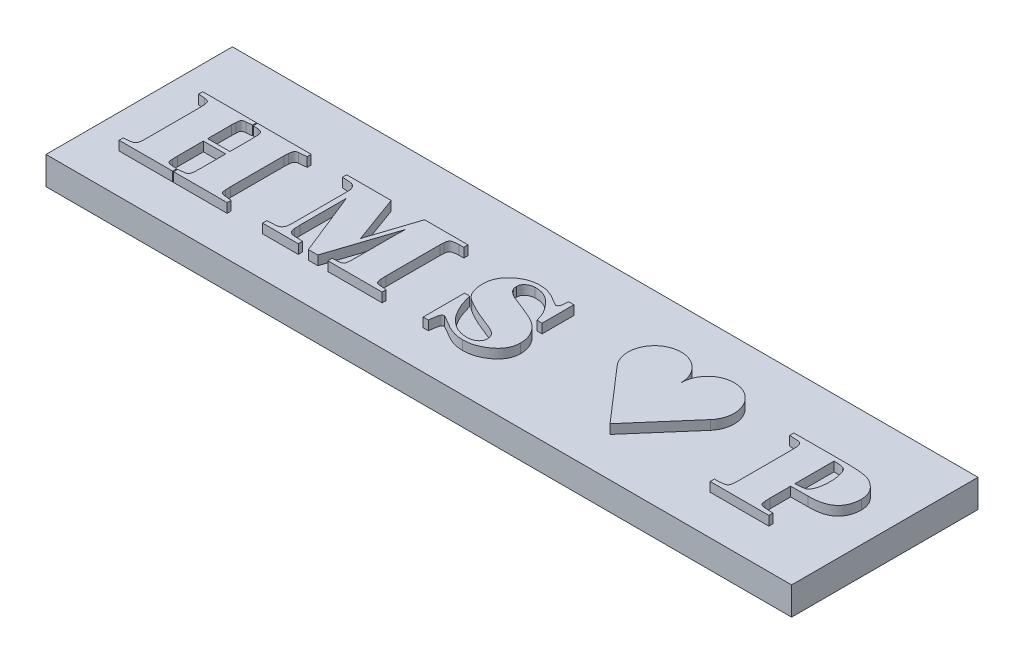
from build123d import *

# Parameters (mm, degrees)
SKETCH1_W           = 40
SKETCH1_H           = 10
BOSS_EXTRUDE1_DEPTH = 1.5
BOSS_EXTRUDE5_DEPTH = 0.5


# Read off the part's stored shape, not the designer's step: Boss-Extrude5
with BuildPart() as part:
    # Sketch1 → Boss-Extrude1 (new body)
    with BuildSketch(Plane(origin=(0, 0, 0), x_dir=(1, 0, 0), z_dir=(0, 1, 0))):
        Rectangle(SKETCH1_W, SKETCH1_H)
    extrude(amount=BOSS_EXTRUDE1_DEPTH)

    # Boss-Extrude5 outline → Boss-Extrude5 (add)
    # profile 1 of 5: a face of its own
    with BuildSketch(Plane(origin=(0, 1.5, 0), x_dir=(1, 0, 0), z_dir=(0, 1, 0))):
        with BuildLine():
            add(Edge.make_bspline(
                [(-15.001582278, -2.634119404), (-14.975088094, -2.630512991), (-14.926695955, -2.623925807), (-14.862529547, -2.607628229), (-14.81380472, -2.587634235), (-14.776593293, -2.562021346), (-14.753440151, -2.522255718), (-14.736625188, -2.470161899), (-14.722599912, -2.402068732), (-14.717697467, -2.35086483), (-14.714992089, -2.322608328)],
                knots=[0, 0, 0, 0, 0.164595913, 0.300637613, 0.40618912, 0.488400851, 0.573033149, 0.683392263, 0.825282312, 1, 1, 1, 1], degree=3))
            Line((-15.001582278, -2.634119404), (-15.27304193, -2.657260227))
            Line((-15.27304193, -2.657260227), (-15.27304193, -2.879768138))
            Line((-15.27304193, -2.879768138), (-12.404469937, -2.879768138))
            Line((-12.404469937, -2.879768138), (-12.404469937, -2.660820353))
            Line((-12.404469937, -2.660820353), (-12.793413766, -2.630559277))
            add(Edge.make_bspline(
                [(-13.039952532, -2.31815817), (-13.036946427, -2.347023814), (-13.031521498, -2.399115823), (-13.016875148, -2.468352375), (-13.0019458, -2.521788281), (-12.979348753, -2.560931128), (-12.947054318, -2.587111254), (-12.905632408, -2.605948226), (-12.853686546, -2.622225913), (-12.81461138, -2.627628478), (-12.793413766, -2.630559277)],
                knots=[0, 0, 0, 0, 0.192076942, 0.346629144, 0.468439447, 0.558431583, 0.640711966, 0.739148355, 0.858492413, 1, 1, 1, 1], degree=3))
            Line((-13.039952532, -2.31815817), (-13.051522943, -2.045808486))
            Line((-13.051522943, -2.045808486), (-13.050632911, 0.826323634))
            Line((-13.050632911, 0.826323634), (-13.039952532, 1.05684183))
            add(Edge.make_bspline(
                [(-12.809434335, 1.368352906), (-12.82678105, 1.365681812), (-12.859742987, 1.360606243), (-12.904375329, 1.344298132), (-12.942031964, 1.323772882), (-12.973774882, 1.296815524), (-12.998230381, 1.257291005), (-13.01654358, 1.204198856), (-13.031443835, 1.135765535), (-13.036937211, 1.084810899), (-13.039952532, 1.05684183)],
                knots=[0, 0, 0, 0, 0.121360463, 0.230607127, 0.327250476, 0.417564353, 0.515640177, 0.645088798, 0.805188763, 1, 1, 1, 1], degree=3))
            Line((-12.809434335, 1.368352906), (-12.392009494, 1.400394046))
            Line((-12.392009494, 1.400394046), (-12.392009494, 1.620231862))
            Line((-12.392009494, 1.620231862), (-15.27304193, 1.620231862))
            Line((-15.27304193, 1.620231862), (-15.27304193, 1.396833919))
            Line((-15.27304193, 1.396833919), (-15.001582278, 1.374583128))
            add(Edge.make_bspline(
                [(-14.714992089, 1.073752432), (-14.717781075, 1.100211011), (-14.722863904, 1.148430847), (-14.736230167, 1.213390793), (-14.755386274, 1.263086825), (-14.779833083, 1.301777767), (-14.817267052, 1.328100202), (-14.8659204, 1.34892689), (-14.929216973, 1.364002081), (-14.976007103, 1.370843599), (-15.001582278, 1.374583128)],
                knots=[0, 0, 0, 0, 0.168055448, 0.306275169, 0.417285206, 0.50357084, 0.590525443, 0.701266249, 0.836714108, 1, 1, 1, 1], degree=3))
            Line((-14.714992089, 1.073752432), (-14.702531646, 0.805852906))
            Line((-14.702531646, 0.805852906), (-14.702531646, -0.430401049))
            Line((-14.702531646, -0.430401049), (-15.898734177, -0.430401049))
            Line((-15.898734177, -0.430401049), (-15.898734177, 0.84590433))
            Line((-15.898734177, 0.84590433), (-15.887163766, 1.076422527))
            add(Edge.make_bspline(
                [(-15.653975475, 1.374583128), (-15.674811462, 1.37207573), (-15.713300338, 1.367443988), (-15.765333061, 1.354590643), (-15.806895732, 1.336816984), (-15.840689669, 1.312828954), (-15.863117639, 1.274512815), (-15.877240936, 1.222713231), (-15.885119672, 1.154975869), (-15.886437556, 1.104330355), (-15.887163766, 1.076422527)],
                knots=[0, 0, 0, 0, 0.142311329, 0.262881868, 0.36199024, 0.448132688, 0.538587183, 0.656370766, 0.810645699, 1, 1, 1, 1], degree=3))
            Line((-15.653975475, 1.374583128), (-15.328223892, 1.401284077))
            Line((-15.328223892, 1.401284077), (-15.328223892, 1.620231862))
            Line((-15.328223892, 1.620231862), (-18.209256329, 1.620231862))
            Line((-18.209256329, 1.620231862), (-18.209256329, 1.396833919))
            Line((-18.209256329, 1.396833919), (-17.860363924, 1.37013297))
            add(Edge.make_bspline(
                [(-17.563093354, 1.05684183), (-17.566278463, 1.083288241), (-17.572114107, 1.131742427), (-17.585295702, 1.197607264), (-17.604685902, 1.248916399), (-17.628664957, 1.289847186), (-17.665641583, 1.319818643), (-17.716922683, 1.3408045), (-17.782847658, 1.35953039), (-17.832926603, 1.366380127), (-17.860363924, 1.37013297)],
                knots=[0, 0, 0, 0, 0.162394421, 0.297533361, 0.408016985, 0.495807726, 0.583094185, 0.692342652, 0.831440274, 1, 1, 1, 1], degree=3))
            Line((-17.563093354, 1.05684183), (-17.550632911, 0.785382178))
            Line((-17.550632911, 0.785382178), (-17.550632911, -2.046698518))
            Line((-17.550632911, -2.046698518), (-17.563093354, -2.317268138))
            add(Edge.make_bspline(
                [(-17.845233386, -2.628779214), (-17.821357263, -2.624958533), (-17.777164319, -2.617886736), (-17.71793914, -2.599119644), (-17.67008328, -2.576704803), (-17.633282481, -2.546275368), (-17.606223354, -2.505812097), (-17.586585747, -2.454093223), (-17.571798582, -2.389971126), (-17.566157743, -2.34286083), (-17.563093354, -2.317268138)],
                knots=[0, 0, 0, 0, 0.153337732, 0.283816832, 0.393342131, 0.486931964, 0.583084326, 0.698878596, 0.836415644, 1, 1, 1, 1], degree=3))
            Line((-17.845233386, -2.628779214), (-18.196795886, -2.657260227))
            Line((-18.196795886, -2.657260227), (-18.196795886, -2.879768138))
            Line((-18.196795886, -2.879768138), (-15.328223892, -2.879768138))
            Line((-15.328223892, -2.879768138), (-15.328223892, -2.661710385))
            Line((-15.328223892, -2.661710385), (-15.652195411, -2.634119404))
            add(Edge.make_bspline(
                [(-15.887163766, -2.324388391), (-15.88661012, -2.354096533), (-15.885615228, -2.407481592), (-15.876092147, -2.478284757), (-15.862580703, -2.531722201), (-15.840028759, -2.570620277), (-15.805496256, -2.593800561), (-15.763680793, -2.611172241), (-15.711541902, -2.625193829), (-15.673039494, -2.630984502), (-15.652195411, -2.634119404)],
                knots=[0, 0, 0, 0, 0.196707415, 0.353480103, 0.472275171, 0.560613516, 0.643561442, 0.74215054, 0.860407813, 1, 1, 1, 1], degree=3))
            Line((-15.887163766, -2.324388391), (-15.899624209, -2.044028423))
            Line((-15.899624209, -2.044028423), (-15.898734177, -0.658249151))
            Line((-15.898734177, -0.658249151), (-14.702531646, -0.658249151))
            Line((-14.702531646, -0.658249151), (-14.702531646, -2.044918454))
            Line((-14.702531646, -2.044918454), (-14.714992089, -2.322608328))
        make_face()
    # profile 2 of 5: a face of its own
    with BuildSketch(Plane(origin=(0, 1.5, 0), x_dir=(1, 0, 0), z_dir=(0, 1, 0))):
        with BuildLine():
            add(Edge.make_bspline(
                [(-6.386075949, 0.185500849), (-6.385966673, 0.218732433), (-6.385739278, 0.287884175), (-6.381591194, 0.395572194), (-6.376669589, 0.511322839), (-6.370539677, 0.599623584), (-6.367089402, 0.649405018), (-6.366492452, 0.6579588)],
                knots=[0, 0, 0, 0, 0.114920202, 0.239137934, 0.372664128, 0.515581263, 0.545234724, 0.545234724, 0.545234724, 0.545234724], degree=3))
            Line((-6.386075949, 0.185500849), (-6.386075949, -2.052038708))
            Line((-6.386075949, -2.052038708), (-6.397646361, -2.326168454))
            add(Edge.make_bspline(
                [(-6.678006329, -2.635009435), (-6.652067274, -2.631506209), (-6.605061195, -2.625157754), (-6.543143429, -2.607893217), (-6.495291351, -2.589623243), (-6.459407089, -2.563762072), (-6.437095992, -2.524374301), (-6.418650145, -2.473172967), (-6.406907234, -2.404786245), (-6.400933303, -2.354072104), (-6.397646361, -2.326168454)],
                knots=[0, 0, 0, 0, 0.163707455, 0.296666386, 0.401561892, 0.483683985, 0.567181473, 0.680033902, 0.823950054, 1, 1, 1, 1], degree=3))
            Line((-6.678006329, -2.635009435), (-7.004647943, -2.656370195))
            Line((-7.004647943, -2.656370195), (-7.004647943, -2.879768138))
            Line((-7.004647943, -2.879768138), (-4.088014241, -2.879768138))
            Line((-4.088014241, -2.879768138), (-4.088014241, -2.660820353))
            Line((-4.088014241, -2.660820353), (-4.492088608, -2.628779214))
            add(Edge.make_bspline(
                [(-4.724386867, -2.31281798), (-4.721386393, -2.34167588), (-4.715905204, -2.394392737), (-4.700953802, -2.464419993), (-4.683987901, -2.518427886), (-4.662364295, -2.558618286), (-4.631337663, -2.58582061), (-4.592835692, -2.604816668), (-4.545742057, -2.620078222), (-4.51089426, -2.625729497), (-4.492088608, -2.628779214)],
                knots=[0, 0, 0, 0, 0.19690421, 0.359699451, 0.485203268, 0.580911852, 0.665067415, 0.760584985, 0.870799419, 1, 1, 1, 1], degree=3))
            Line((-4.724386867, -2.31281798), (-4.735067247, -2.037798201))
            Line((-4.735067247, -2.037798201), (-4.734177215, 0.8619249))
            Line((-4.734177215, 0.8619249), (-4.724386867, 1.077312558))
            add(Edge.make_bspline(
                [(-4.232199367, 1.392383761), (-4.242587625, 1.392184308), (-4.268153352, 1.391693451), (-4.313263674, 1.387697337), (-4.372504947, 1.380966417), (-4.441325305, 1.374466318), (-4.51065137, 1.363564741), (-4.571704893, 1.349942896), (-4.618850992, 1.329395722), (-4.656153669, 1.304248888), (-4.6815141, 1.266041589), (-4.70011188, 1.216171792), (-4.714890366, 1.151762824), (-4.721009359, 1.103791405), (-4.724386867, 1.077312558)],
                knots=[0, 0, 0, 0, 0.046034389, 0.113291624, 0.200550599, 0.310312985, 0.419467395, 0.511620618, 0.586375576, 0.646595457, 0.707882266, 0.785762784, 0.881747206, 1, 1, 1, 1], degree=3))
            Line((-4.232199367, 1.392383761), (-3.97943038, 1.392383761))
            Line((-3.97943038, 1.392383761), (-3.97943038, 1.620231862))
            Line((-3.97943038, 1.620231862), (-6.308643196, 1.620231862))
            Line((-6.308643196, 1.620231862), (-7.158623418, -0.967980163))
            Line((-7.158623418, -0.967980163), (-8.103837025, 1.620231862))
            Line((-8.103837025, 1.620231862), (-10.487341772, 1.620231862))
            Line((-10.487341772, 1.620231862), (-10.487341772, 1.397723951))
            add(Edge.make_bspline(
                [(-9.701443829, 1.047941514), (-9.708158775, 1.068262827), (-9.721371436, 1.108248055), (-9.74759381, 1.164254744), (-9.780680367, 1.21373942), (-9.816534533, 1.258364122), (-9.857882945, 1.296909669), (-9.905616879, 1.325969597), (-9.957967284, 1.348323708), (-10.035013064, 1.36289366), (-10.134005242, 1.373829734), (-10.253247261, 1.380874899), (-10.371162334, 1.387172193), (-10.448790387, 1.394222601), (-10.487341772, 1.397723951)],
                knots=[0, 0, 0, 0, 0.06814184, 0.134079279, 0.1961954, 0.257296956, 0.316158012, 0.375155444, 0.434469865, 0.496377191, 0.623900921, 0.751753331, 0.876716566, 1, 1, 1, 1], degree=3))
            Line((-9.701443829, 1.047941514), (-9.689873418, 0.785382178))
            Line((-9.689873418, 0.785382178), (-9.689873418, -1.980836176))
            Line((-9.689873418, -1.980836176), (-9.702333861, -2.265646303))
            add(Edge.make_bspline(
                [(-10.499802215, -2.656370195), (-10.455020611, -2.653374172), (-10.372612604, -2.647860831), (-10.25228625, -2.644651974), (-10.133232416, -2.636761794), (-10.029416923, -2.627634191), (-9.943697327, -2.610332429), (-9.884600016, -2.588654419), (-9.833866076, -2.557361702), (-9.791231816, -2.517621995), (-9.756620013, -2.467841933), (-9.730518042, -2.408868795), (-9.711503574, -2.34047336), (-9.705511836, -2.291579344), (-9.702333861, -2.265646303)],
                knots=[0, 0, 0, 0, 0.13348818, 0.245647628, 0.357942385, 0.488430381, 0.555241526, 0.617522313, 0.674582857, 0.731397213, 0.789666415, 0.85364336, 0.922373468, 1, 1, 1, 1], degree=3))
            Line((-10.499802215, -2.656370195), (-10.499802215, -2.879768138))
            Line((-10.499802215, -2.879768138), (-8.586234177, -2.879768138))
            Line((-8.586234177, -2.879768138), (-8.586234177, -2.659930322))
            Line((-8.586234177, -2.659930322), (-9.107792722, -2.623439024))
            add(Edge.make_bspline(
                [(-9.394382911, -2.261196144), (-9.390783184, -2.290650787), (-9.384109705, -2.345256293), (-9.366900942, -2.419943902), (-9.343187202, -2.48093864), (-9.312602866, -2.529553931), (-9.272719052, -2.565850424), (-9.22577697, -2.5935624), (-9.169843227, -2.613431253), (-9.129307552, -2.61996902), (-9.107792722, -2.623439024)],
                knots=[0, 0, 0, 0, 0.173653238, 0.321933046, 0.447391543, 0.555296573, 0.65484072, 0.759984849, 0.872608873, 1, 1, 1, 1], degree=3))
            Line((-9.394382911, -2.261196144), (-9.405953323, -1.976386018))
            Line((-9.405953323, -1.976386018), (-9.405141196, 0.525775601))
            Line((-9.405141196, 0.525775601), (-8.042424842, -2.879768138))
            Line((-8.042424842, -2.879768138), (-7.537776899, -2.879768138))
            Line((-7.537776899, -2.879768138), (-6.459948576, 0.383087875))
            Line((-6.459948576, 0.383087875), (-6.366492452, 0.6579588))
        make_face()
    # profile 3 of 5: a face of its own
    with BuildSketch(Plane(origin=(0, 1.5, 0), x_dir=(1, 0, 0), z_dir=(0, 1, 0))):
        with BuildLine():
            add(Edge.make_bspline(
                [(-0.746835443, 0.993649584), (-0.74536001, 0.95842561), (-0.74249664, 0.890066537), (-0.71357404, 0.793357329), (-0.668669437, 0.705995609), (-0.603755642, 0.631635803), (-0.527420634, 0.567156181), (-0.445570191, 0.506667308), (-0.356004261, 0.454420477), (-0.25734597, 0.407073125), (-0.144667653, 0.360479114), (-0.013883882, 0.308281701), (0.137444834, 0.248222158), (0.308051562, 0.183948023), (0.491479239, 0.113524641), (0.6810593, 0.035060839), (0.873906708, -0.049940556), (1.036966169, -0.123406026), (1.166770258, -0.18671078), (1.260009579, -0.241691302), (1.34885612, -0.302101642), (1.433592047, -0.368097492), (1.513873299, -0.439441978), (1.589901358, -0.516508727), (1.661850119, -0.598899601), (1.728524322, -0.686893583), (1.788876412, -0.779372907), (1.843064278, -0.875473692), (1.886977569, -0.976281789), (1.924099957, -1.080248302), (1.952159892, -1.187816566), (1.97315274, -1.29897335), (1.984349061, -1.413952778), (1.986335531, -1.491890867), (1.987341772, -1.531370195)],
                knots=[0, 0, 0, 0, 0.026271138, 0.050984329, 0.074800032, 0.099199579, 0.124200839, 0.149448905, 0.175206422, 0.201598111, 0.231222891, 0.266362204, 0.306898554, 0.352960473, 0.402685656, 0.453811837, 0.506362542, 0.560266849, 0.587549755, 0.614297078, 0.64112432, 0.667838504, 0.694551766, 0.721376256, 0.748735718, 0.776288763, 0.803854307, 0.831262293, 0.858674767, 0.885968494, 0.913734162, 0.941711718, 0.970474228, 1, 1, 1, 1], degree=3))
            add(Edge.make_bspline(
                [(-0.202136076, 1.449345786), (-0.234013839, 1.447723663), (-0.298004884, 1.444467432), (-0.39279841, 1.420267455), (-0.484917774, 1.380392708), (-0.572263029, 1.327489082), (-0.649550989, 1.262385069), (-0.706636807, 1.18288901), (-0.741484666, 1.091590917), (-0.745019546, 1.026888002), (-0.746835443, 0.993649584)],
                knots=[0, 0, 0, 0, 0.121610338, 0.244119151, 0.370969357, 0.503632024, 0.632866389, 0.753858137, 0.873554906, 1, 1, 1, 1], degree=3))
            add(Edge.make_bspline(
                [(1.374109968, -0.031666872), (1.366252482, -0.00491851), (1.349324649, 0.052707016), (1.318896671, 0.143670451), (1.282854018, 0.245684404), (1.242135678, 0.359117718), (1.187943269, 0.483058575), (1.111420705, 0.613435213), (1.012804652, 0.750848998), (0.897967234, 0.891908944), (0.774700527, 1.027880985), (0.647559053, 1.146348937), (0.522471806, 1.244702954), (0.394835115, 1.321584863), (0.261617118, 1.380230712), (0.117943026, 1.420972334), (-0.038145377, 1.44510274), (-0.146272122, 1.447900379), (-0.202136076, 1.449345786)],
                knots=[0, 0, 0, 0, 0.035906866, 0.077356214, 0.123523959, 0.175272454, 0.232580615, 0.297470079, 0.369568945, 0.450258278, 0.531668307, 0.605756047, 0.673860524, 0.736251134, 0.797168506, 0.860787532, 0.92807553, 1, 1, 1, 1], degree=3))
            Line((1.374109968, -0.031666872), (1.64556962, -0.031666872))
            Line((1.64556962, -0.031666872), (1.64556962, 1.677193887))
            Line((1.64556962, 1.677193887), (1.360759494, 1.677193887))
            add(Edge.make_bspline(
                [(1.178303006, 1.164535659), (1.192872855, 1.16611171), (1.222179591, 1.169281879), (1.261974291, 1.195146357), (1.293186389, 1.236979688), (1.318646727, 1.293485071), (1.337323053, 1.366025505), (1.351001358, 1.454845522), (1.35973843, 1.56042975), (1.360403904, 1.636530286), (1.360759494, 1.677193887)],
                knots=[0, 0, 0, 0, 0.073703244, 0.148251473, 0.233102023, 0.336401283, 0.461618154, 0.612966137, 0.793192121, 1, 1, 1, 1], degree=3))
            Line((1.178303006, 1.164535659), (0.583761867, 1.497407495))
            add(Edge.make_bspline(
                [(-0.151404272, 1.677193887), (-0.088669325, 1.674811072), (0.036760548, 1.670046961), (0.223461219, 1.636204065), (0.407108198, 1.579076769), (0.524376168, 1.524862271), (0.583761867, 1.497407495)],
                knots=[0, 0, 0, 0, 0.246456156, 0.49275509, 0.74312599, 1, 1, 1, 1], degree=3))
            add(Edge.make_bspline(
                [(-1.772151899, 0.21309183), (-1.770584598, 0.263318996), (-1.767488695, 0.362533112), (-1.743736956, 0.508230636), (-1.705228705, 0.648151664), (-1.65210364, 0.782405892), (-1.581383277, 0.909612003), (-1.496616821, 1.031214238), (-1.395830924, 1.146385972), (-1.282070313, 1.254886716), (-1.157864776, 1.35293449), (-1.028274161, 1.440388709), (-0.893451668, 1.513453288), (-0.754060649, 1.57338875), (-0.609880315, 1.620170959), (-0.46104509, 1.652343669), (-0.307809254, 1.674269383), (-0.203994346, 1.676210543), (-0.151404272, 1.677193887)],
                knots=[0, 0, 0, 0, 0.062204273, 0.122872591, 0.182349013, 0.241728823, 0.301276751, 0.362251589, 0.425042733, 0.490555683, 0.556740526, 0.620861198, 0.684017035, 0.74641971, 0.80860552, 0.871475145, 0.934892476, 1, 1, 1, 1], degree=3))
            add(Edge.make_bspline(
                [(-1.299545095, -0.858506271), (-1.337294966, -0.833309104), (-1.412645338, -0.783014473), (-1.50885915, -0.685490655), (-1.592233855, -0.574408744), (-1.657649818, -0.445982441), (-1.709456485, -0.303075208), (-1.746267496, -0.144762208), (-1.768712504, 0.029100011), (-1.770974832, 0.150124171), (-1.772151899, 0.21309183)],
                knots=[0, 0, 0, 0, 0.110755835, 0.221073428, 0.333112562, 0.449304402, 0.572116466, 0.704119735, 0.846056458, 1, 1, 1, 1], degree=3))
            add(Edge.make_bspline(
                [(0.905063291, -2.25318586), (0.903638351, -2.215668361), (0.900927406, -2.144291419), (0.87744058, -2.04314882), (0.838314346, -1.954006155), (0.779669218, -1.875399333), (0.699005258, -1.803819236), (0.591835205, -1.736708201), (0.458422197, -1.666880931), (0.29850886, -1.600971646), (0.122358616, -1.531570348), (-0.062505211, -1.457751458), (-0.25350044, -1.380752915), (-0.451637308, -1.301633817), (-0.656204154, -1.21307565), (-0.86491792, -1.107577365), (-1.081888599, -0.990930949), (-1.225767948, -0.903393123), (-1.299545095, -0.858506271)],
                knots=[0, 0, 0, 0, 0.041215804, 0.078412958, 0.113463202, 0.147527654, 0.185409671, 0.231382499, 0.286256452, 0.350862845, 0.421448381, 0.494517961, 0.569768794, 0.647928615, 0.729160766, 0.814813628, 0.905041812, 1, 1, 1, 1], degree=3))
            add(Edge.make_bspline(
                [(0.299841772, -2.708882062), (0.342972755, -2.707136062), (0.425856079, -2.703780833), (0.543912079, -2.679370402), (0.648605233, -2.635925879), (0.738241526, -2.576467933), (0.811054726, -2.505819446), (0.865750025, -2.428129845), (0.898890077, -2.342617796), (0.902996322, -2.283130238), (0.905063291, -2.25318586)],
                knots=[0, 0, 0, 0, 0.153956857, 0.295853595, 0.427853137, 0.556237336, 0.677585662, 0.788058432, 0.893314524, 1, 1, 1, 1], degree=3))
            add(Edge.make_bspline(
                [(-1.56210443, -0.715211176), (-1.553270159, -0.745491974), (-1.534105484, -0.811181788), (-1.501464417, -0.917420743), (-1.465370947, -1.039860605), (-1.42450843, -1.178196528), (-1.37192461, -1.330019444), (-1.299271269, -1.491990632), (-1.210706271, -1.665713384), (-1.107591439, -1.847655387), (-0.987903058, -2.027571665), (-0.847811739, -2.19235002), (-0.69200729, -2.339964983), (-0.549798186, -2.448814862), (-0.428537427, -2.524803854), (-0.333637698, -2.573597317), (-0.236172142, -2.616333518), (-0.134868267, -2.649265996), (-0.030741784, -2.67691872), (0.07685647, -2.694798257), (0.187409631, -2.707156805), (0.26212859, -2.708303358), (0.299841772, -2.708882062)],
                knots=[0, 0, 0, 0, 0.032058659, 0.069546626, 0.112955303, 0.161793716, 0.216152654, 0.276098588, 0.342040466, 0.414297442, 0.48856181, 0.561299738, 0.633604513, 0.706334941, 0.742899623, 0.77890806, 0.814699962, 0.850933678, 0.887061852, 0.924092282, 0.96168681, 1, 1, 1, 1], degree=3))
            Line((-1.56210443, -0.715211176), (-1.829113924, -0.715211176))
            Line((-1.829113924, -0.715211176), (-1.829113924, -2.936730163))
            Line((-1.829113924, -2.936730163), (-1.552314082, -2.936730163))
            add(Edge.make_bspline(
                [(-1.321795886, -2.310147885), (-1.338073421, -2.311374451), (-1.369558207, -2.313746935), (-1.412760509, -2.336774587), (-1.444107136, -2.376220962), (-1.463878713, -2.417990381), (-1.475933731, -2.460596388), (-1.485384881, -2.502597884), (-1.496249944, -2.553247493), (-1.506778845, -2.612934215), (-1.517041751, -2.681285437), (-1.529114278, -2.758308481), (-1.540198542, -2.844458415), (-1.548146251, -2.904988032), (-1.552314082, -2.936730163)],
                knots=[0, 0, 0, 0, 0.06776762, 0.131079364, 0.198000285, 0.275177456, 0.323096399, 0.383019194, 0.455330472, 0.539828243, 0.636570394, 0.74454424, 0.866037313, 1, 1, 1, 1], degree=3))
            add(Edge.make_bspline(
                [(0.282041139, -2.936730163), (0.237508146, -2.935551227), (0.148815224, -2.933203232), (0.016001476, -2.918915356), (-0.115270458, -2.893514907), (-0.246390826, -2.859933425), (-0.375731015, -2.814942338), (-0.504849579, -2.76169424), (-0.631898955, -2.697034862), (-0.755523834, -2.625245695), (-0.870499752, -2.552069173), (-0.976400028, -2.489246695), (-1.067169195, -2.434455229), (-1.14524722, -2.391457136), (-1.20783822, -2.355408793), (-1.258281757, -2.332272507), (-1.293755696, -2.314709063), (-1.314300334, -2.311367154), (-1.321795886, -2.310147885)],
                knots=[0, 0, 0, 0, 0.076481606, 0.152322503, 0.229061601, 0.305922368, 0.38454598, 0.464023294, 0.54559101, 0.629131657, 0.709435825, 0.779596701, 0.84058432, 0.891454838, 0.93272505, 0.964398351, 0.987011014, 1, 1, 1, 1], degree=3))
            add(Edge.make_bspline(
                [(1.987341772, -1.531370195), (1.985889377, -1.580423199), (1.983017973, -1.677401568), (1.957566251, -1.819563196), (1.914950031, -1.955226142), (1.857569739, -2.085513714), (1.780003914, -2.20752681), (1.689466899, -2.325591288), (1.579158782, -2.434722839), (1.455991692, -2.537447141), (1.322976705, -2.631107563), (1.183562844, -2.711618471), (1.042231431, -2.781940443), (0.896631239, -2.837973497), (0.748075375, -2.88311554), (0.595436233, -2.913710723), (0.439789758, -2.933256171), (0.334908417, -2.935565903), (0.282041139, -2.936730163)],
                knots=[0, 0, 0, 0, 0.060199253, 0.119014636, 0.176627426, 0.234515987, 0.29325121, 0.353735287, 0.416847988, 0.483315961, 0.55052655, 0.616320213, 0.68083878, 0.744161416, 0.807668221, 0.871255433, 0.935104045, 1, 1, 1, 1], degree=3))
        make_face()
    # profile 4 of 5: a face of its own
    with BuildSketch(Plane(origin=(0, 1.5, 0), x_dir=(1, 0, 0), z_dir=(0, 1, 0))):
        with BuildLine():
            add(Edge.make_bspline(
                [(15.896756329, -2.314598043), (15.900029258, -2.343182675), (15.906006646, -2.395387134), (15.922033115, -2.464765372), (15.939872112, -2.519211585), (15.96640644, -2.557948301), (15.999399172, -2.584460119), (16.038113328, -2.603640436), (16.083803584, -2.617942568), (16.155030415, -2.63008692), (16.252584508, -2.638699696), (16.377635211, -2.644398726), (16.514189019, -2.648443099), (16.608837664, -2.659470194), (16.658623418, -2.665270511)],
                knots=[0, 0, 0, 0, 0.089334166, 0.163152069, 0.221218087, 0.266243072, 0.306859461, 0.351400241, 0.399810796, 0.45515502, 0.575632115, 0.703973068, 0.844288063, 1, 1, 1, 1], degree=3))
            Line((15.896756329, -2.314598043), (15.885185918, -2.040468296))
            Line((15.885185918, -2.040468296), (15.886075949, -0.938609119))
            add(Edge.make_bspline(
                [(16.818829114, -0.931488866), (16.755933284, -0.93139613), (16.636667769, -0.931220281), (16.467563374, -0.932389361), (16.317740054, -0.933146761), (16.187798693, -0.93424693), (16.079200037, -0.934488299), (15.99377694, -0.936941916), (15.932055636, -0.937436976), (15.898832543, -0.93828392), (15.886075949, -0.938609119)],
                knots=[0, 0, 0, 0, 0.202279889, 0.383570981, 0.543871091, 0.684134449, 0.801498829, 0.893117146, 0.958960439, 1, 1, 1, 1], degree=3))
            add(Edge.make_bspline(
                [(18.392405063, 0.356386925), (18.391359033, 0.312138933), (18.389274149, 0.223946444), (18.373072447, 0.092814518), (18.344889972, -0.03622911), (18.307278625, -0.162464363), (18.258855092, -0.284066869), (18.192943887, -0.395101823), (18.116994611, -0.498734998), (18.025135353, -0.590083403), (17.922068452, -0.672028245), (17.806563482, -0.741921834), (17.680333857, -0.802133314), (17.5411882, -0.85024928), (17.386961757, -0.888123144), (17.214338527, -0.912476644), (17.022963582, -0.928887903), (16.888884315, -0.930596263), (16.818829114, -0.931488866)],
                knots=[0, 0, 0, 0, 0.057065209, 0.11373901, 0.17010708, 0.227250505, 0.283534078, 0.33840533, 0.393357922, 0.448830372, 0.504949787, 0.562836689, 0.62257612, 0.685026518, 0.752409338, 0.82709527, 0.909658846, 1, 1, 1, 1], degree=3))
            add(Edge.make_bspline(
                [(16.387163766, 1.625572052), (16.469945608, 1.624913788), (16.628464222, 1.623653282), (16.855657809, 1.613508842), (17.061355359, 1.594568677), (17.246101271, 1.570809093), (17.40911294, 1.538194509), (17.551189501, 1.498783864), (17.671978275, 1.451387525), (17.773139289, 1.395918911), (17.858199713, 1.335092928), (17.936129403, 1.275570618), (18.007028534, 1.215165002), (18.071983609, 1.154704685), (18.128557351, 1.092349215), (18.17918369, 1.0296029), (18.222653761, 0.965901907), (18.27101742, 0.880326964), (18.320012523, 0.771184349), (18.362070748, 0.635853255), (18.388006391, 0.497118847), (18.390936527, 0.40337153), (18.392405063, 0.356386925)],
                knots=[0, 0, 0, 0, 0.092479581, 0.177088773, 0.253965738, 0.323197368, 0.385077075, 0.439526139, 0.487716456, 0.529694894, 0.56803394, 0.604428348, 0.639227337, 0.672051015, 0.703486614, 0.733197595, 0.762062811, 0.789523871, 0.84293001, 0.895344802, 0.947548545, 1, 1, 1, 1], degree=3))
            Line((16.387163766, 1.625572052), (13.503461234, 1.620231862))
            Line((13.503461234, 1.620231862), (13.503461234, 1.395943887))
            add(Edge.make_bspline(
                [(14.221716772, 1.05150164), (14.218601565, 1.077662245), (14.212891484, 1.125613844), (14.198741768, 1.191427423), (14.176618553, 1.243448498), (14.14926121, 1.284474566), (14.113825655, 1.314112309), (14.072279487, 1.337527043), (14.022355586, 1.354069807), (13.947816379, 1.368062576), (13.854077188, 1.377926046), (13.742338101, 1.38398867), (13.62649742, 1.387438762), (13.546464322, 1.392971212), (13.503461234, 1.395943887)],
                knots=[0, 0, 0, 0, 0.086557298, 0.158656916, 0.220210345, 0.271308782, 0.318983879, 0.370480407, 0.427190938, 0.490838204, 0.619343219, 0.736492367, 0.858413057, 1, 1, 1, 1], degree=3))
            Line((14.221716772, 1.05150164), (14.234177215, 0.779151957))
            Line((14.234177215, 0.779151957), (14.234177215, -2.046698518))
            Line((14.234177215, -2.046698518), (14.221716772, -2.31815817))
            add(Edge.make_bspline(
                [(13.751780063, -2.651920037), (13.791225125, -2.646392107), (13.868290536, -2.635591968), (13.963177903, -2.624961797), (14.034165584, -2.614072675), (14.079340021, -2.59712884), (14.118712332, -2.57724694), (14.151816613, -2.549010475), (14.178865726, -2.510175688), (14.198441761, -2.457969123), (14.212947371, -2.392618841), (14.218633224, -2.344340467), (14.221716772, -2.31815817)],
                knots=[0, 0, 0, 0, 0.17998444, 0.351642879, 0.432127665, 0.503392336, 0.568787835, 0.630606754, 0.697953168, 0.780380817, 0.880896263, 1, 1, 1, 1], degree=3))
            Line((13.751780063, -2.651920037), (13.509691456, -2.651920037))
            Line((13.509691456, -2.651920037), (13.509691456, -2.879768138))
            Line((13.509691456, -2.879768138), (16.658623418, -2.879768138))
            Line((16.658623418, -2.879768138), (16.658623418, -2.665270511))
        make_face()
        with BuildLine():
            add(Edge.make_bspline(
                [(15.886075949, -0.715211176), (15.889919625, -0.714242435), (15.902735991, -0.711012261), (15.930021835, -0.709767113), (15.972052886, -0.706535221), (16.028269116, -0.704893573), (16.096480571, -0.699009607), (16.174988646, -0.691657574), (16.262027697, -0.67797164), (16.34011759, -0.667229382), (16.404213234, -0.65079373), (16.450672732, -0.630113232), (16.493104572, -0.6000436), (16.531117921, -0.561219349), (16.566346402, -0.514872784), (16.598348392, -0.460660381), (16.62543019, -0.397514752), (16.659148084, -0.302057525), (16.691437673, -0.170923464), (16.719714365, -0.003417998), (16.738152488, 0.175598833), (16.73970666, 0.29908154), (16.740506329, 0.362617147)],
                knots=[0, 0, 0, 0, 0.007235509, 0.024126103, 0.049667218, 0.084414085, 0.126840348, 0.17481383, 0.228501197, 0.287880137, 0.318797379, 0.349138474, 0.380283191, 0.413262574, 0.448081315, 0.486494571, 0.528013384, 0.573468444, 0.67146271, 0.774351508, 0.883896991, 1, 1, 1, 1], degree=3))
            Line((15.886075949, -0.715211176), (15.886075949, 1.392383761))
            add(Edge.make_bspline(
                [(16.740506329, 0.362617147), (16.73954769, 0.41665525), (16.737641431, 0.52411026), (16.720267257, 0.683599813), (16.691541946, 0.839952686), (16.659331847, 0.966407822), (16.629160988, 1.062645605), (16.602478831, 1.126131948), (16.574079163, 1.182597764), (16.542260027, 1.230244174), (16.508287391, 1.27090348), (16.470284743, 1.30168124), (16.430966476, 1.327467248), (16.344805585, 1.354362562), (16.213531576, 1.378895478), (16.070165314, 1.388449725), (15.969450131, 1.39059354), (15.91929289, 1.391090136), (15.894382169, 1.392060277), (15.886075949, 1.392383761)],
                knots=[0, 0, 0, 0, 0.101326501, 0.201488203, 0.300479219, 0.399268288, 0.446075168, 0.489477233, 0.52830041, 0.564413111, 0.5967631, 0.627184468, 0.655909756, 0.684244353, 0.795444025, 0.905934202, 0.953244414, 0.984409838, 1, 1, 1, 1], degree=3))
        make_face(mode=Mode.SUBTRACT)
    # profile 5 of 5: a face of its own
    with BuildSketch(Plane(origin=(0, 1.5, 0), x_dir=(1, 0, 0), z_dir=(0, 1, 0))):
        with BuildLine():
            Line((5.63996494, 0.000231862), (8.13996494, -2.879768138))
            Line((8.13996494, -2.879768138), (10.63996494, 0.000231862))
            ThreePointArc((10.63996494, 0.000231862), (10.062683148, 2.268280718), (8.13996494, 0.933943964))
            ThreePointArc((8.13996494, 0.933943964), (6.217246732, 2.268280718), (5.63996494, 0.000231862))
        make_face()
    extrude(amount=BOSS_EXTRUDE5_DEPTH)


solid = part.part
